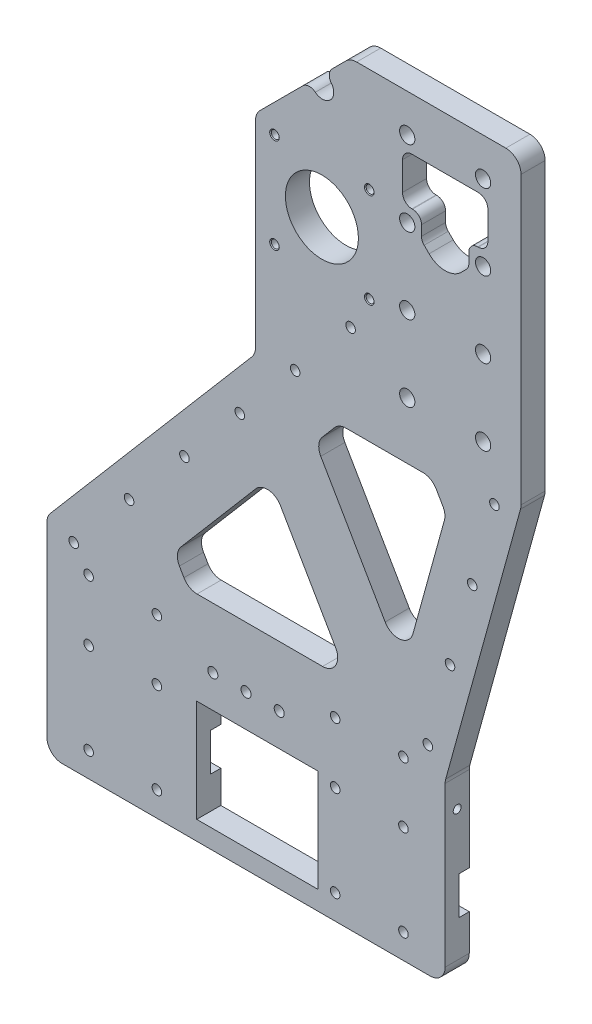
from build123d import *

# Parameters (mm, degrees)
SKETCH1_R                               = 2.525
SKETCH1_R_2                             = 4.025
SKETCH1_W                               = 64
SKETCH1_H                               = 54
BOSS_EXTRUDE1_DEPTH                     = 12.7
CHAMFER1_SIZE                           = 50
FILLET1_R                               = 8
CUT_EXTRUDE_THIN1_DEPTH                 = 450.234114911
CUT_EXTRUDE_THIN1_DEPTH_BACK            = 5.5
SKETCH2_W                               = 210
SKETCH2_H                               = 20
SKETCH5_R                               = 19.25
SKETCH5_R_2                             = 2.1
CUT_EXTRUDE1_DEPTH                      = 12.7
M5X0_8_TAPPED_HOLE1_D                   = 4.2
M5X0_8_TAPPED_HOLE1_CSINK_D             = 5.05
M5X0_8_TAPPED_HOLE1_CSINK_ANGLE         = 90
SKETCH9_R                               = 2.525
CUT_EXTRUDE2_DEPTH                      = 450.234114911
CRVPATTERN1_OUTLINE_R                   = 2.525
CRVPATTERN1_DEPTH                       = 12.7
SKETCH10_R                              = 2.525
CUT_EXTRUDE3_DEPTH                      = 450.234114911
LPATTERN1_COUNT                         = 4
LPATTERN1_PITCH                         = 44
CUT_EXTRUDE4_DEPTH                      = 450.234114911
CBORE_FOR_M5_HEX_HEAD_BOLT1_D           = 5.3
CBORE_FOR_M5_HEX_HEAD_BOLT1_CBORE_D     = 12.24
CBORE_FOR_M5_HEX_HEAD_BOLT1_CBORE_DEPTH = 4.08
M5X0_8_TAPPED_HOLE2_D                   = 4.2
M5X0_8_TAPPED_HOLE2_DEPTH               = 24
M5X0_8_TAPPED_HOLE2_TIP                 = 1.2618073
CUT_EXTRUDE5_REACH                      = 451.234
SKETCH19_R                              = 6
FILLET2_R                               = 5
CUT_EXTRUDE6_DEPTH                      = 12.7
FILLET3_R                               = 5


# Read off the part's stored shape, not the designer's step: CrvPattern1
with BuildPart() as part:
    # Sketch1 → Boss-Extrude1 (new body)
    with BuildSketch(Plane.XY):
        Polygon((-105, 0), (105, 0), (105, 120), (145, 265), (145, 425), (5, 425), (5, 265), (-105, 136), align=None)
        with Locations((-83, 8)):
            Circle(SKETCH1_R, mode=Mode.SUBTRACT)
        with Locations((-47, 8)):
            Circle(SKETCH1_R, mode=Mode.SUBTRACT)
        with Locations(Location((83, 8, 0), (0, 0, 180))):
            Circle(SKETCH1_R, mode=Mode.SUBTRACT)
        with Locations(Location((47, 8, 0), (0, 0, 180))):
            Circle(SKETCH1_R, mode=Mode.SUBTRACT)
        with Locations((-83, 40)):
            Circle(SKETCH1_R, mode=Mode.SUBTRACT)
        with Locations((-47, 40)):
            Circle(SKETCH1_R, mode=Mode.SUBTRACT)
        with Locations(Location((47, 40, 0), (0, 0, 180))):
            Circle(SKETCH1_R, mode=Mode.SUBTRACT)
        with Locations(Location((83, 40, 0), (0, 0, 180))):
            Circle(SKETCH1_R, mode=Mode.SUBTRACT)
        with Locations((-83, 120)):
            Circle(SKETCH1_R, mode=Mode.SUBTRACT)
        with Locations((-47, 120)):
            Circle(SKETCH1_R, mode=Mode.SUBTRACT)
        with Locations((-83, 88)):
            Circle(SKETCH1_R, mode=Mode.SUBTRACT)
        with Locations((-47, 88)):
            Circle(SKETCH1_R, mode=Mode.SUBTRACT)
        with Locations(Location((47, 120, 0), (0, 0, 180))):
            Circle(SKETCH1_R, mode=Mode.SUBTRACT)
        with Locations(Location((83, 120, 0), (0, 0, 180))):
            Circle(SKETCH1_R, mode=Mode.SUBTRACT)
        with Locations(Location((47, 88, 0), (0, 0, 180))):
            Circle(SKETCH1_R, mode=Mode.SUBTRACT)
        with Locations(Location((83, 88, 0), (0, 0, 180))):
            Circle(SKETCH1_R, mode=Mode.SUBTRACT)
        with Locations((125, 405)):
            Circle(SKETCH1_R_2, mode=Mode.SUBTRACT)
        with Locations((85, 405)):
            Circle(SKETCH1_R_2, mode=Mode.SUBTRACT)
        with Locations((85, 365)):
            Circle(SKETCH1_R_2, mode=Mode.SUBTRACT)
        with Locations((85, 325)):
            Circle(SKETCH1_R_2, mode=Mode.SUBTRACT)
        with Locations((85, 285)):
            Circle(SKETCH1_R_2, mode=Mode.SUBTRACT)
        with Locations((125, 365)):
            Circle(SKETCH1_R_2, mode=Mode.SUBTRACT)
        with Locations((125, 325)):
            Circle(SKETCH1_R_2, mode=Mode.SUBTRACT)
        with Locations((125, 285)):
            Circle(SKETCH1_R_2, mode=Mode.SUBTRACT)
        with Locations((6, 64)):
            Rectangle(SKETCH1_W, SKETCH1_H, mode=Mode.SUBTRACT)
        Polygon((-37.94998621, 152.983486009), (12.483833036, 212.128601306), (54.215691301, 140), (-30.438056294, 140), align=None, mode=Mode.SUBTRACT)
        Polygon((49.040839674, 255), (97.952523144, 255), (105.464453059, 242.016513991), (82.917000564, 160.281998696), (36.574213435, 240.38004741), align=None, mode=Mode.SUBTRACT)
    extrude(amount=BOSS_EXTRUDE1_DEPTH)

    # Chamfer1
    chamfer1_edges = [part.edges().sort_by_distance(p)[0] for p in [
        (5, 425, 6.35),
    ]]
    chamfer(chamfer1_edges, length=CHAMFER1_SIZE)

    # Fillet1
    fillet1_edges = [part.edges().sort_by_distance(p)[0] for p in [
        (105, 120, 6.35),
        (105, 0, 6.35),
        (-105, 0, 6.35),
        (-105, 136, 6.35),
        (5, 265, 6.35),
        (145, 425, 6.35),
        (145, 265, 6.35),
        (49.040839674, 255, 6.35),
        (36.574213435, 240.38004741, 6.35),
        (82.917000564, 160.281998696, 6.35),
        (105.464453059, 242.016513991, 6.35),
        (97.952523144, 255, 6.35),
        (5, 375, 6.35),
        (55, 425, 6.35),
        (-37.94998621, 152.983486009, 6.35),
        (-30.438056294, 140, 6.35),
        (54.215691301, 140, 6.35),
        (12.483833036, 212.128601306, 6.35),
    ]]
    fillet(fillet1_edges, radius=FILLET1_R)

    # Sketch2 → Cut-Extrude-Thin1 (cut, two sides: drawn at the far end of the back side and taken through both)
    with BuildSketch(Plane(origin=(0, 0, 0), x_dir=(-1, 0, 0), z_dir=(0, 0, -1)).offset(-CUT_EXTRUDE_THIN1_DEPTH_BACK)):
        with Locations((0, 64)):
            Rectangle(SKETCH2_W, SKETCH2_H)
    extrude(amount=CUT_EXTRUDE_THIN1_DEPTH + CUT_EXTRUDE_THIN1_DEPTH_BACK, mode=Mode.SUBTRACT)

    # Sketch5 → Cut-Extrude1 (cut)
    with BuildSketch(Plane.XY.offset(12.7)):
        with Locations((40, 345)):
            Circle(SKETCH5_R)
        with Locations((65, 370)):
            Circle(SKETCH5_R_2)
        with Locations((15, 370)):
            Circle(SKETCH5_R_2)
        with Locations((65, 320)):
            Circle(SKETCH5_R_2)
        with Locations((15, 320)):
            Circle(SKETCH5_R_2)
    extrude(amount=-CUT_EXTRUDE1_DEPTH, mode=Mode.SUBTRACT)

    # M5x0.8 Tapped Hole1 (through all)
    with Locations(Plane.XY.offset(12.7)):
        with Locations((65, 370), (15, 370), (15, 320), (65, 320)):
            CounterSinkHole(M5X0_8_TAPPED_HOLE1_D / 2, M5X0_8_TAPPED_HOLE1_CSINK_D / 2, counter_sink_angle=M5X0_8_TAPPED_HOLE1_CSINK_ANGLE)

    # Sketch9 → Cut-Extrude2 (cut, through all)
    with BuildSketch(Plane(origin=(0, 0, 0), x_dir=(-1, 0, 0), z_dir=(0, 0, -1))):
        with Locations((90.864775882, 131)):
            Circle(SKETCH9_R)
    extrude(amount=-CUT_EXTRUDE2_DEPTH, mode=Mode.SUBTRACT)

    # CrvPattern1 outline → CrvPattern1 (cut)
    with BuildSketch(Plane.XY):
        with Locations((55.12561317, 302.206910797)):
            Circle(CRVPATTERN1_OUTLINE_R)
        with Locations((25.92753536, 267.965528637)):
            Circle(CRVPATTERN1_OUTLINE_R)
        with Locations((-3.270542451, 233.724146478)):
            Circle(CRVPATTERN1_OUTLINE_R)
        with Locations((-32.468620261, 199.482764319)):
            Circle(CRVPATTERN1_OUTLINE_R)
        with Locations((-61.666698071, 165.241382159)):
            Circle(CRVPATTERN1_OUTLINE_R)
    extrude(amount=CRVPATTERN1_DEPTH, mode=Mode.SUBTRACT)

    # Sketch10 → Cut-Extrude3 (cut, through all)
    with BuildSketch(Plane(origin=(0, 0, 0), x_dir=(-1, 0, 0), z_dir=(0, 0, -1))):
        with Locations((-95.862116726, 132)):
            Circle(SKETCH10_R)
    cut_extrude3 = extrude(amount=-CUT_EXTRUDE3_DEPTH, mode=Mode.SUBTRACT)

    # LPattern1: Cut-Extrude3 ×4
    with Locations(*[Vector(0.26592899812581366, 0.9639926182060737, 0) * (i * LPATTERN1_PITCH) for i in range(1, LPATTERN1_COUNT)]):
        add(cut_extrude3, mode=Mode.SUBTRACT)

    # Sketch11 → Cut-Extrude4 (cut, through all)
    with BuildSketch(Plane.XY.offset(12.7)):
        with BuildLine():
            Line((-97, 27), (97, 27))
            ThreePointArc((97, 27), (102.656854249, 29.343145751), (105, 35))
            Line((105, 35), (105, 8))
            ThreePointArc((105, 8), (102.656854249, 2.343145751), (97, 0))
            Line((97, 0), (-97, 0))
            ThreePointArc((-97, 0), (-102.656854249, 2.343145751), (-105, 8))
            Line((-105, 8), (-105, 35))
            ThreePointArc((-105, 35), (-102.656854249, 29.343145751), (-97, 27))
        make_face()
    extrude(amount=-CUT_EXTRUDE4_DEPTH, mode=Mode.SUBTRACT)

    # CBORE for M5 Hex Head Bolt1 (through all)
    with Locations(Plane(origin=(0, 0, 0), x_dir=(-1, 0, 0), z_dir=(0, 0, -1))):
        with Locations((-17.5, 108.2), (0, 108.2), (17.5, 108.2)):
            CounterBoreHole(CBORE_FOR_M5_HEX_HEAD_BOLT1_D / 2, CBORE_FOR_M5_HEX_HEAD_BOLT1_CBORE_D / 2, CBORE_FOR_M5_HEX_HEAD_BOLT1_CBORE_DEPTH)

    # M5x0.8 Tapped Hole2
    with Locations(Plane(origin=(105, 0, 0), x_dir=(0, 0, -1), z_dir=(1, 0, 0))):
        with Locations((-6.35, 104)):
            Hole(M5X0_8_TAPPED_HOLE2_D / 2, depth=M5X0_8_TAPPED_HOLE2_DEPTH)
            with Locations((0, 0, -(M5X0_8_TAPPED_HOLE2_DEPTH + M5X0_8_TAPPED_HOLE2_TIP / 2))):  # 118° drill point
                Cone(0, M5X0_8_TAPPED_HOLE2_D / 2, M5X0_8_TAPPED_HOLE2_TIP, mode=Mode.SUBTRACT)

    # Sketch19 → Cut-Extrude5 (cut, up to next)
    with BuildSketch(Plane.XY.offset(12.7), mode=Mode.PRIVATE) as cut_extrude5_sk1:
        with Locations((40.25, 405)):
            Circle(SKETCH19_R)
    cut_extrude5_tool1 = extrude(cut_extrude5_sk1.sketch, amount=-CUT_EXTRUDE5_REACH, mode=Mode.PRIVATE) & part.part
    add(cut_extrude5_tool1.solids().sort_by_distance((40.25, 405, 12.7))[0], mode=Mode.SUBTRACT)

    # Fillet2
    fillet2_edges = [part.edges().sort_by_distance(p)[0] for p in [
        (40.958072906, 410.958072906, 6.35),
        (34.291927094, 404.291927094, 6.35),
    ]]
    fillet(fillet2_edges, radius=FILLET2_R)

    # Sketch21 → Cut-Extrude6 (cut)
    with BuildSketch(Plane.XY.offset(12.7)):
        with BuildLine():
            Line((122.2214, 397.4714), (87.7786, 397.4714))
            Line((87.7786, 397.4714), (82.493615716, 397.4714))
            Line((82.493615716, 397.4714), (82.493615716, 372.5286))
            Line((82.493615716, 372.5286), (87.7786, 372.5286))
            ThreePointArc((87.7786, 372.5286), (91.137357211, 371.137357211), (92.5286, 367.7786))
            Line((92.5286, 367.7786), (92.5286, 362.493615716))
            ThreePointArc((92.5286, 362.493615716), (92.890172221, 360.675869412), (93.919842789, 359.134858505))
            Line((93.919842789, 359.134858505), (96.527350647, 356.527350647))
            ThreePointArc((96.527350647, 356.527350647), (105, 353.017864376), (113.472649353, 356.527350647))
            Line((113.472649353, 356.527350647), (116.080157211, 359.134858505))
            ThreePointArc((116.080157211, 359.134858505), (117.109827779, 360.675869412), (117.4714, 362.493615716))
            Line((117.4714, 362.493615716), (117.4714, 367.7786))
            ThreePointArc((117.4714, 367.7786), (118.862642789, 371.137357211), (122.2214, 372.5286))
            Line((122.2214, 372.5286), (127.506384284, 372.5286))
            Line((127.506384284, 372.5286), (127.506384284, 397.4714))
            Line((127.506384284, 397.4714), (122.2214, 397.4714))
        make_face()
    extrude(amount=-CUT_EXTRUDE6_DEPTH, mode=Mode.SUBTRACT)

    # Fillet3
    fillet3_edges = [part.edges().sort_by_distance(p)[0] for p in [
        (82.493615716, 372.5286, 6.35),
        (82.493615716, 397.4714, 6.35),
        (127.506384284, 397.4714, 6.35),
        (127.506384284, 372.5286, 6.35),
    ]]
    fillet(fillet3_edges, radius=FILLET3_R)


solid = part.part
